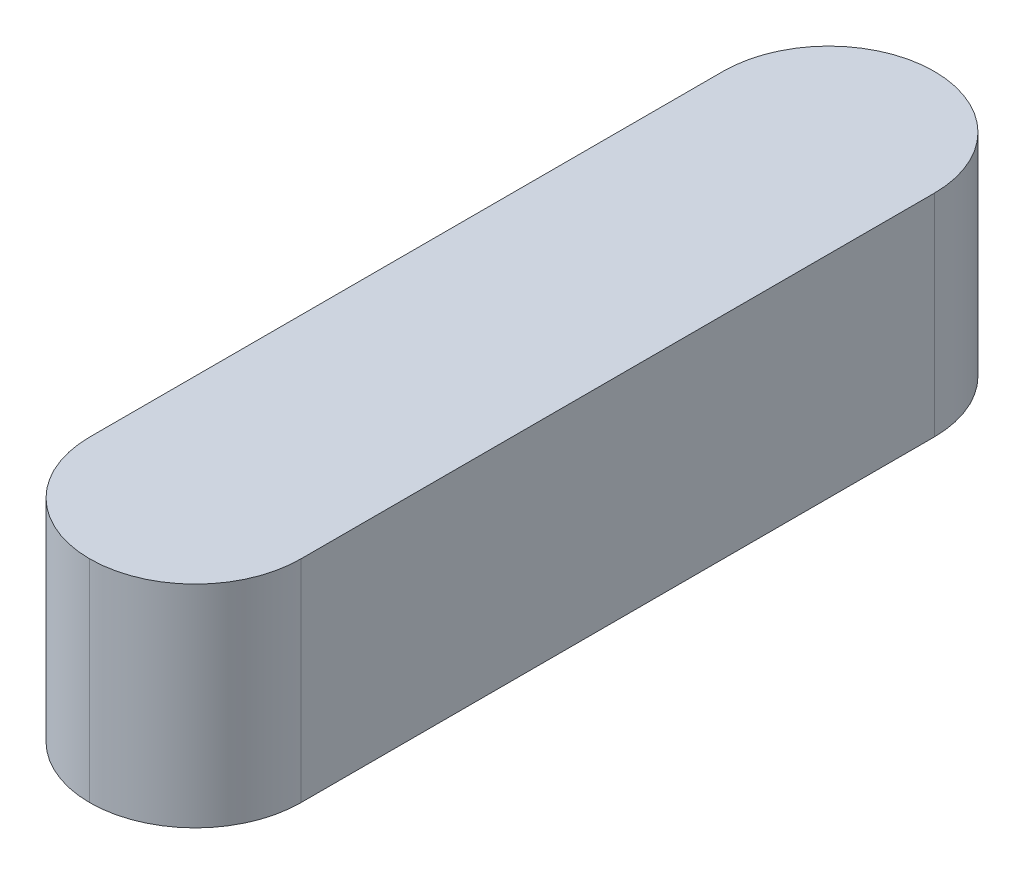
from build123d import *

# Parameters (mm, degrees)
SKETCH1_W          = 4
SKETCH1_H          = 4
KEYEXTRUSION_DEPTH = 16
ENDRADII_R         = 2


with BuildPart() as part:
    # Sketch1 → KeyExtrusion (new body)
    with BuildSketch(Plane.XY):
        with Locations((2, 2)):
            Rectangle(SKETCH1_W, SKETCH1_H)
    extrude(amount=KEYEXTRUSION_DEPTH)

    # EndRadii
    endradii_edges = [part.edges().sort_by_distance(p)[0] for p in [
        (0, 2, 0),
        (4, 2, 0),
        (0, 2, 16),
        (4, 2, 16),
    ]]
    fillet(endradii_edges, radius=ENDRADII_R - 0.0001)  # a hair under: the kernel refuses the full size


solid = part.part
